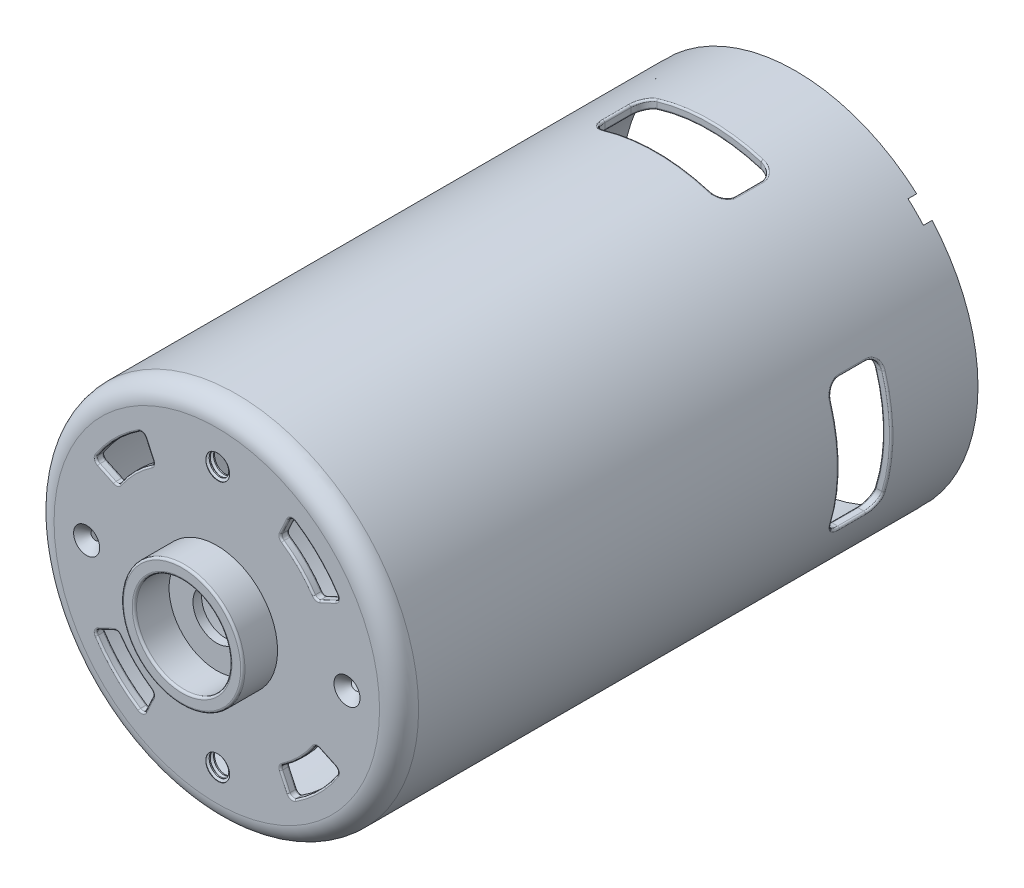
from build123d import *

# Parameters (mm, degrees)
SKETCH1_R                    = 21
SHELL_DEPTH                  = 33.35
FILLET1_R                    = 2.25
SHELL1_T                     = -1
CUT_EXTRUDE1_REACH           = 46.657
CUT_EXTRUDE1_END_RADIUS      = 21
CIRPATTERN1_COUNT            = 4
TAP_DRILL_FOR_M3_TAP1_D      = 2.5
THREAD3_PITCH                = 0.5
THREAD4_PITCH                = 0.5
CUT_EXTRUDE3_DEPTH           = 1
CIRPATTERN4_COUNT            = 4
SKETCH31_R                   = 7
SKETCH31_R_2                 = 5.5
BOSS_EXTRUDE2_DEPTH          = 4
FILLET2_R                    = 0.25
SKETCH32_R                   = 2.75
SHAFT_HOLE_DEPTH             = 1
CUT_EXTRUDE5_DEPTH           = 1
CIRPATTERN5_COUNT            = 4
SKETCH35_R                   = 1.5
CUT_EXTRUDE6_DEPTH           = 1
CUT_EXTRUDE6_DRAFT           = -45
CUT_EXTRUDE6_PROFILE_2_DEPTH = 1
CUT_EXTRUDE6_PROFILE_2_DRAFT = -45
FILLET3_R                    = 0.2


with BuildPart() as part:
    # Sketch1 → Shell (new, symmetric)
    with BuildSketch(Plane.XY):
        Circle(SKETCH1_R)
    extrude(amount=SHELL_DEPTH, both=True)

    # Fillet1
    fillet1_edges = [part.edges().sort_by_distance(p)[0] for p in [
        (-21, 0, 33.35),
    ]]
    fillet(fillet1_edges, radius=FILLET1_R)

    # Shell1
    shell1_openings = [part.faces().sort_by_distance(p)[0] for p in [
        (0, 0, -33.35),
    ]]
    offset(amount=SHELL1_T, openings=shell1_openings, kind=Kind.INTERSECTION)

    # Cut-Extrude1: up to this cylinder (the profile starts inside it)
    cut_extrude1_end = Plane(origin=(0, 0, -20.35), z_dir=(0, 0, -1)) * Cylinder(CUT_EXTRUDE1_END_RADIUS, 136.314, mode=Mode.PRIVATE)
    # Sketch2 → Cut-Extrude1 (cut, up to the surface)
    with BuildSketch(Plane(origin=(0, 0, 0), x_dir=(1, 0, 0), z_dir=(0, 1, 0)), mode=Mode.PRIVATE) as cut_extrude1_sk1:
        with BuildLine():
            Line((-6, 23.35), (6, 23.35))
            ThreePointArc((6, 23.35), (7.060660172, 22.910660172), (7.5, 21.85))
            Line((7.5, 21.85), (7.5, 18.85))
            ThreePointArc((7.5, 18.85), (7.060660172, 17.789339828), (6, 17.35))
            Line((6, 17.35), (-6, 17.35))
            ThreePointArc((-6, 17.35), (-7.060660172, 17.789339828), (-7.5, 18.85))
            Line((-7.5, 18.85), (-7.5, 21.85))
            ThreePointArc((-7.5, 21.85), (-7.060660172, 22.910660172), (-6, 23.35))
        make_face()
    cut_extrude1_tool1 = extrude(cut_extrude1_sk1.sketch, amount=-CUT_EXTRUDE1_REACH, mode=Mode.PRIVATE) & cut_extrude1_end
    cut_extrude1 = cut_extrude1_tool1.solids().sort_by_distance((0, 0, -20.35))[0]
    add(cut_extrude1, mode=Mode.SUBTRACT)

    # CirPattern1: Cut-Extrude1 ×4 about axis
    cirpattern1_axis = Axis((0, 0, 0), (0, 0, 1))
    for i in range(1, CIRPATTERN1_COUNT):
        add(cut_extrude1.rotate(cirpattern1_axis, i * 360 / CIRPATTERN1_COUNT), mode=Mode.SUBTRACT)

    # Tap Drill for M3 Tap1 (through all)
    with Locations(Plane.XY.offset(33.35)):
        with Locations((0, 15), (0, -15)):
            Hole(TAP_DRILL_FOR_M3_TAP1_D / 2)

    # Thread3: the profile of Thread Profile4 profile screwed along a right-hand helix of 4 turns, 6 arcs to a turn; built about Z, then put on its axis
    thread3_z = Axis((0, 0, 0), (0, 0, 1))
    thread3_corners = [(1.2497, 0, -0.000173205), (1.520632938, 0, 0.156249999), (1.520632937, 0, 0.218749999), (1.2497, 0, 0.375173204)]
    with BuildLine(mode=Mode.PRIVATE) as thread3_profile:
        Line(thread3_corners[0], thread3_corners[1])
        Line(thread3_corners[1], thread3_corners[2])
        Line(thread3_corners[2], thread3_corners[3])
        Line(thread3_corners[3], thread3_corners[0])
    thread3_cap = Face(thread3_profile.wire())
    thread3_turn_angles = [0, 30, 60, 90, 120, 150, 180, 210, 240, 270, 300, 330, 360]
    thread3_turn_weights = [1, 0.8660254037844387, 1, 0.8660254037844387, 1, 0.8660254037844387, 1, 0.8660254037844387, 1, 0.8660254037844387, 1, 0.8660254037844387, 1]
    thread3_turn_rails = [Edge.make_bspline([Vector(p[0], p[1], 0).rotate(thread3_z, thread3_turn_angles[k]) / thread3_turn_weights[k] + Vector(0, 0, p[2] + THREAD3_PITCH * thread3_turn_angles[k] / 360) for k in range(13)], [0, 0, 0, 1, 1, 2, 2, 3, 3, 4, 4, 5, 5, 6, 6, 6], 2, thread3_turn_weights) for p in thread3_corners]
    thread3_turn_sides = [Face.make_surface_from_curves(thread3_turn_rails[p[0]], thread3_turn_rails[p[1]]) for p in [(0, 1), (1, 2), (2, 3), (3, 0)]]
    thread3 = Plane(origin=(0, -15, 34.35), x_dir=(-1, 0, 0), z_dir=(0, 0, -1)) * Solid(Shell([*[p.moved(Location((0, 0, THREAD3_PITCH * i))) for i in range(4) for p in thread3_turn_sides], thread3_cap, thread3_cap.rotate(thread3_z, 1440).moved(Location((0, 0, THREAD3_PITCH * 1440 / 360)))]))
    add(thread3, mode=Mode.SUBTRACT)

    # Thread4: the profile of Thread Profile5 profile screwed along a right-hand helix of 4 turns, 6 arcs to a turn; built about Z, then put on its axis
    thread4_z = Axis((0, 0, 0), (0, 0, 1))
    thread4_corners = [(1.2497, 0, -0.000173205), (1.520632937, 0, 0.156249999), (1.520632937, 0, 0.218749999), (1.2497, 0, 0.375173204)]
    with BuildLine(mode=Mode.PRIVATE) as thread4_profile:
        Line(thread4_corners[0], thread4_corners[1])
        Line(thread4_corners[1], thread4_corners[2])
        Line(thread4_corners[2], thread4_corners[3])
        Line(thread4_corners[3], thread4_corners[0])
    thread4_cap = Face(thread4_profile.wire())
    thread4_turn_angles = [0, 30, 60, 90, 120, 150, 180, 210, 240, 270, 300, 330, 360]
    thread4_turn_weights = [1, 0.8660254037844387, 1, 0.8660254037844387, 1, 0.8660254037844387, 1, 0.8660254037844387, 1, 0.8660254037844387, 1, 0.8660254037844387, 1]
    thread4_turn_rails = [Edge.make_bspline([Vector(p[0], p[1], 0).rotate(thread4_z, thread4_turn_angles[k]) / thread4_turn_weights[k] + Vector(0, 0, p[2] + THREAD4_PITCH * thread4_turn_angles[k] / 360) for k in range(13)], [0, 0, 0, 1, 1, 2, 2, 3, 3, 4, 4, 5, 5, 6, 6, 6], 2, thread4_turn_weights) for p in thread4_corners]
    thread4_turn_sides = [Face.make_surface_from_curves(thread4_turn_rails[p[0]], thread4_turn_rails[p[1]]) for p in [(0, 1), (1, 2), (2, 3), (3, 0)]]
    thread4 = Plane(origin=(0, 15, 34.35), x_dir=(-1, 0, 0), z_dir=(0, 0, -1)) * Solid(Shell([*[p.moved(Location((0, 0, THREAD4_PITCH * i))) for i in range(4) for p in thread4_turn_sides], thread4_cap, thread4_cap.rotate(thread4_z, 1440).moved(Location((0, 0, THREAD4_PITCH * 1440 / 360)))]))
    add(thread4, mode=Mode.SUBTRACT)

    # Sketch30 → Cut-Extrude3 (cut)
    with BuildSketch(Plane(origin=(0, 0, -33.35), x_dir=(-1, 0, 0), z_dir=(0, 0, -1))):
        Polygon((-15.733125881, 13.965358928), (-14.998370715, 13.230603762), (-13.230603762, 14.998370715), (-13.965358928, 15.733125881), align=None)
    cut_extrude3 = extrude(amount=-CUT_EXTRUDE3_DEPTH, mode=Mode.SUBTRACT)

    # CirPattern4: Cut-Extrude3 ×4 about axis
    cirpattern4_axis = Axis((0, 0, 0), (0, 0, 1))
    for i in range(1, CIRPATTERN4_COUNT):
        add(cut_extrude3.rotate(cirpattern4_axis, i * 360 / CIRPATTERN4_COUNT), mode=Mode.SUBTRACT)

    # Sketch31 → Boss-Extrude2 (add)
    with BuildSketch(Plane.XY.offset(33.35)):
        Circle(SKETCH31_R)
        Circle(SKETCH31_R_2, mode=Mode.SUBTRACT)
    extrude(amount=BOSS_EXTRUDE2_DEPTH)

    # Fillet2
    fillet2_edges = [part.edges().sort_by_distance(p)[0] for p in [
        (-7, 0, 37.35),
        (-5.5, 0, 37.35),
    ]]
    fillet(fillet2_edges, radius=FILLET2_R)

    # Sketch32 → Shaft Hole (cut)
    with BuildSketch(Plane.XY.offset(33.35)):
        Circle(SKETCH32_R)
    extrude(amount=-SHAFT_HOLE_DEPTH, mode=Mode.SUBTRACT)

    # Sketch33 → Cut-Extrude5 (cut)
    with BuildSketch(Plane.XY.offset(33.35)):
        with BuildLine():
            Line((-8.252137253, 13.635835419), (-7.397477792, 11.80301229))
            ThreePointArc((-7.397477792, 11.80301229), (-7.368690354, 11.458539527), (-7.570251983, 11.177713761))
            ThreePointArc((-7.570251983, 11.177713761), (-9.545941546, 9.545941546), (-11.177713761, 7.570251983))
            ThreePointArc((-11.177713761, 7.570251983), (-11.458539527, 7.368690354), (-11.80301229, 7.397477792))
            Line((-11.80301229, 7.397477792), (-13.635835419, 8.252137253))
            ThreePointArc((-13.635835419, 8.252137253), (-13.905111243, 8.567312523), (-13.844042734, 8.977331495))
            ThreePointArc((-13.844042734, 8.977331495), (-11.66726189, 11.66726189), (-8.977331495, 13.844042734))
            ThreePointArc((-8.977331495, 13.844042734), (-8.567312523, 13.905111243), (-8.252137253, 13.635835419))
        make_face()
    cut_extrude5 = extrude(amount=-CUT_EXTRUDE5_DEPTH, mode=Mode.SUBTRACT)

    # CirPattern5: Cut-Extrude5 ×4 about axis
    cirpattern5_axis = Axis((0, 0, 0), (0, 0, 1))
    for i in range(1, CIRPATTERN5_COUNT):
        add(cut_extrude5.rotate(cirpattern5_axis, i * 360 / CIRPATTERN5_COUNT), mode=Mode.SUBTRACT)


with BuildPart() as cut_extrude6_tool:
    # Sketch35 → Cut-Extrude6 (with draft: the straight prism first)
    with BuildSketch(Plane.XY.offset(33.35)):
        with Locations((15, 0)):
            Circle(SKETCH35_R)
    extrude(amount=-CUT_EXTRUDE6_DEPTH)
    # Cut-Extrude6: the draft: its side faces are tilted about the plane it starts from
    cut_extrude6_sides = [cut_extrude6_tool.faces().sort_by_distance(p)[0] for p in [
        (13.5, 0, 32.85),
    ]]
    draft(cut_extrude6_sides, Plane.XY.offset(33.35), CUT_EXTRUDE6_DRAFT)


with BuildPart() as part_1:
    add(part.part)

    # Cut-Extrude6: cut by cut_extrude6_tool
    add(cut_extrude6_tool.part, mode=Mode.SUBTRACT)


with BuildPart() as cut_extrude6_profile_2_tool:
    # Sketch35 → Cut-Extrude6 profile 2 (with draft: the straight prism first)
    with BuildSketch(Plane.XY.offset(33.35)):
        with Locations((-15, 0)):
            Circle(SKETCH35_R)
    extrude(amount=-CUT_EXTRUDE6_PROFILE_2_DEPTH)
    # Cut-Extrude6 profile 2: the draft: its side faces are tilted about the plane it starts from
    cut_extrude6_profile_2_sides = [cut_extrude6_profile_2_tool.faces().sort_by_distance(p)[0] for p in [
        (-16.5, 0, 32.85),
    ]]
    draft(cut_extrude6_profile_2_sides, Plane.XY.offset(33.35), CUT_EXTRUDE6_PROFILE_2_DRAFT)


with BuildPart() as part_2:
    add(part_1.part)

    # Cut-Extrude6 profile 2: cut by cut_extrude6_profile_2_tool
    add(cut_extrude6_profile_2_tool.part, mode=Mode.SUBTRACT)

    # Fillet3
    fillet3_edges = [part_2.edges().sort_by_distance(p)[0] for p in [
        (0, -20, -23.35),
        (-7.0469523, -18.717383984, -22.92419314),
        (-7.5, -18.540496218, -20.35),
        (-7.046952296, -18.717383987, -17.775806865),
        (0, -20, -17.35),
        (7.046952302, -18.717383983, -17.775806858),
        (7.5, -18.540496218, -20.35),
        (7.046952296, -18.717383987, -22.924193135),
        (0, -21, -23.35),
        (7.048278335, -19.781854628, -22.922899126),
        (7.5, -19.615045246, -20.35),
        (7.048278341, -19.781854624, -17.777100867),
        (0, -21, -17.35),
        (-7.048278335, -19.781854628, -17.777100874),
        (-7.5, -19.615045246, -20.35),
        (-7.048278339, -19.781854625, -22.922899131),
        (-7.368690354, 11.458539527, 33.35),
        (-7.824807523, 12.719423854, 33.35),
        (-8.567312523, 13.905111243, 33.35),
        (-11.66726189, 11.66726189, 33.35),
        (-13.905111243, 8.567312523, 33.35),
        (-12.719423854, 7.824807523, 33.35),
        (-11.458539527, 7.368690354, 33.35),
        (-9.545941546, 9.545941546, 33.35),
        (-7.368690354, 11.458539527, 32.35),
        (-9.545941546, 9.545941546, 32.35),
        (-11.458539527, 7.368690354, 32.35),
        (-12.719423854, 7.824807523, 32.35),
        (-13.905111243, 8.567312523, 32.35),
        (-11.66726189, 11.66726189, 32.35),
        (-8.567312523, 13.905111243, 32.35),
        (-7.824807523, 12.719423854, 32.35),
        (11.458539527, 7.368690354, 33.35),
        (12.719423854, 7.824807523, 33.35),
        (13.905111243, 8.567312523, 33.35),
        (11.66726189, 11.66726189, 33.35),
        (8.567312523, 13.905111243, 33.35),
        (7.824807523, 12.719423854, 33.35),
        (7.368690354, 11.458539527, 33.35),
        (9.545941546, 9.545941546, 33.35),
        (11.458539527, 7.368690354, 32.35),
        (9.545941546, 9.545941546, 32.35),
        (7.368690354, 11.458539527, 32.35),
        (7.824807523, 12.719423854, 32.35),
        (8.567312523, 13.905111243, 32.35),
        (11.66726189, 11.66726189, 32.35),
        (13.905111243, 8.567312523, 32.35),
        (12.719423854, 7.824807523, 32.35),
        (7.368690354, -11.458539527, 33.35),
        (7.824807523, -12.719423854, 33.35),
        (8.567312523, -13.905111243, 33.35),
        (11.66726189, -11.66726189, 33.35),
        (13.905111243, -8.567312523, 33.35),
        (12.719423854, -7.824807523, 33.35),
        (11.458539527, -7.368690354, 33.35),
        (9.545941546, -9.545941546, 33.35),
        (7.368690354, -11.458539527, 32.35),
        (9.545941546, -9.545941546, 32.35),
        (11.458539527, -7.368690354, 32.35),
        (12.719423854, -7.824807523, 32.35),
        (13.905111243, -8.567312523, 32.35),
        (11.66726189, -11.66726189, 32.35),
        (8.567312523, -13.905111243, 32.35),
        (7.824807523, -12.719423854, 32.35),
        (-11.458539527, -7.368690354, 33.35),
        (-12.719423854, -7.824807523, 33.35),
        (-13.905111243, -8.567312523, 33.35),
        (-11.66726189, -11.66726189, 33.35),
        (-8.567312523, -13.905111243, 33.35),
        (-7.824807523, -12.719423854, 33.35),
        (-7.368690354, -11.458539527, 33.35),
        (-9.545941546, -9.545941546, 33.35),
        (-11.458539527, -7.368690354, 32.35),
        (-9.545941546, -9.545941546, 32.35),
        (-7.368690354, -11.458539527, 32.35),
        (-7.824807523, -12.719423854, 32.35),
        (-8.567312523, -13.905111243, 32.35),
        (-11.66726189, -11.66726189, 32.35),
        (-13.905111243, -8.567312523, 32.35),
        (-12.719423854, -7.824807523, 32.35),
        (18.717383983, 7.046952302, -17.775806858),
        (18.540496218, 7.5, -20.35),
        (18.717383987, 7.046952296, -22.924193135),
        (19.768354516, -3.035153986, -23.35),
        (19.768354516, -3.035153986, -17.35),
        (18.717383987, -7.046952296, -17.775806865),
        (18.540496218, -7.5, -20.35),
        (18.717383984, -7.0469523, -22.92419314),
        (7.046952302, 18.717383983, -22.924193142),
        (7.5, 18.540496218, -20.35),
        (7.046952296, 18.717383987, -17.775806865),
        (0, 20, -23.35),
        (0, 20, -17.35),
        (-7.046952297, 18.717383987, -17.775806866),
        (-7.5, 18.540496218, -20.35),
        (-7.5, 19.615045246, -20.35),
        (-20, 0, -23.35),
        (-20, 0, -23.35),
        (-18.540496218, 7.5, -20.35),
        (-18.717383987, 7.046952296, -17.775806865),
        (-20, 0, -17.35),
        (-18.717383987, -7.046952297, -17.775806866),
        (-18.540496218, -7.5, -20.35),
        (-18.717383987, -7.046952296, -22.924193135),
        (-21, 0, -23.35),
        (-19.781854628, -7.048278335, -22.922899126),
        (-19.615045246, -7.5, -20.35),
        (-19.781854624, -7.048278341, -17.777100867),
        (-21, 0, -17.35),
        (-19.781854628, 7.048278335, -17.777100874),
        (-19.615045246, 7.5, -20.35),
        (-19.781854625, 7.048278339, -22.922899131),
        (0, 21, -23.35),
        (-7.048278335, 19.781854628, -22.922899126),
        (-7.5, 19.615045246, -20.35),
        (-7.048278341, 19.781854624, -17.777100867),
        (0, 21, -17.35),
        (7.048278335, 19.781854628, -17.777100874),
        (7.5, 19.615045246, -20.35),
        (7.048278339, 19.781854625, -22.922899131),
        (20.780000574, -3.031761225, -23.35),
        (19.781854628, 7.048278335, -22.922899126),
        (19.615045246, 7.5, -20.35),
        (19.781854624, 7.048278341, -17.777100867),
        (20.780000574, -3.031761225, -17.35),
        (19.781854628, -7.048278335, -17.777100874),
        (19.615045246, -7.5, -20.35),
        (19.781854625, -7.048278339, -22.922899131),
    ]]
    fillet(fillet3_edges, radius=FILLET3_R)


solid = part_2.part
